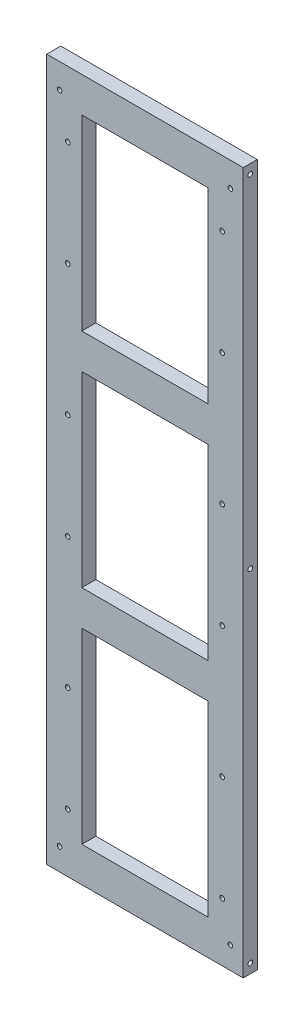
from build123d import *

# Parameters (mm, degrees)
SKETCH1_W           = 84
SKETCH1_H           = 300
SKETCH1_W_2         = 54
SKETCH1_H_2         = 80
BOSS_EXTRUDE1_DEPTH = 6
SKETCH2_R           = 1
CUT_EXTRUDE1_DEPTH  = 10
SKETCH4_R           = 1
CUT_EXTRUDE3_DEPTH  = 10
SKETCH5_R           = 1
CUT_EXTRUDE4_DEPTH  = 10


with BuildPart() as part:
    # Sketch1 → Boss-Extrude1 (new body)
    with BuildSketch(Plane.XY):
        Rectangle(SKETCH1_W, SKETCH1_H)
        with Locations((0, 95)):
            Rectangle(SKETCH1_W_2, SKETCH1_H_2, mode=Mode.SUBTRACT)
        with Locations((0, -95)):
            Rectangle(SKETCH1_W_2, SKETCH1_H_2, mode=Mode.SUBTRACT)
        Rectangle(SKETCH1_W_2, SKETCH1_H_2, mode=Mode.SUBTRACT)
    extrude(amount=BOSS_EXTRUDE1_DEPTH)

    # Sketch2 → Cut-Extrude1 (cut)
    with BuildSketch(Plane(origin=(42, 0, 0), x_dir=(0, 0, -1), z_dir=(1, 0, 0))):
        with Locations((-3, 146)):
            Circle(SKETCH2_R)
        with Locations((-3, 0)):
            Circle(SKETCH2_R)
        with Locations((-3, -146)):
            Circle(SKETCH2_R)
        with Locations((-3, -292)):
            Circle(SKETCH2_R)
    cut_extrude1 = extrude(amount=-CUT_EXTRUDE1_DEPTH, mode=Mode.SUBTRACT)

    # Mirror1: Cut-Extrude1 across plane
    add(cut_extrude1.mirror(Plane(origin=(0, 0, 0), x_dir=(0, 0, 1), z_dir=(1, 0, 0))), mode=Mode.SUBTRACT)

    # Sketch4 → Cut-Extrude3 (cut)
    with BuildSketch(Plane.XY.offset(6)):
        with Locations((-33, 122)):
            Circle(SKETCH4_R)
        with Locations((-33, -125)):
            Circle(SKETCH4_R)
        with Locations((-33, 77)):
            Circle(SKETCH4_R)
        with Locations((-33, -80)):
            Circle(SKETCH4_R)
        with Locations((-33, 21)):
            Circle(SKETCH4_R)
        with Locations((-33, -24)):
            Circle(SKETCH4_R)
        with Locations((33, -24)):
            Circle(SKETCH4_R)
        with Locations((33, 21)):
            Circle(SKETCH4_R)
        with Locations((33, -80)):
            Circle(SKETCH4_R)
        with Locations((33, 77)):
            Circle(SKETCH4_R)
        with Locations((33, -125)):
            Circle(SKETCH4_R)
        with Locations((33, 122)):
            Circle(SKETCH4_R)
    extrude(amount=-CUT_EXTRUDE3_DEPTH, mode=Mode.SUBTRACT)

    # Sketch5 → Cut-Extrude4 (cut)
    with BuildSketch(Plane.XY.offset(6)):
        with Locations((-36.5, -140.5)):
            Circle(SKETCH5_R)
        with Locations((36.5, -140.5)):
            Circle(SKETCH5_R)
        with Locations((-36.5, 139.5)):
            Circle(SKETCH5_R)
        with Locations((36.5, 139.5)):
            Circle(SKETCH5_R)
    extrude(amount=-CUT_EXTRUDE4_DEPTH, mode=Mode.SUBTRACT)


solid = part.part
